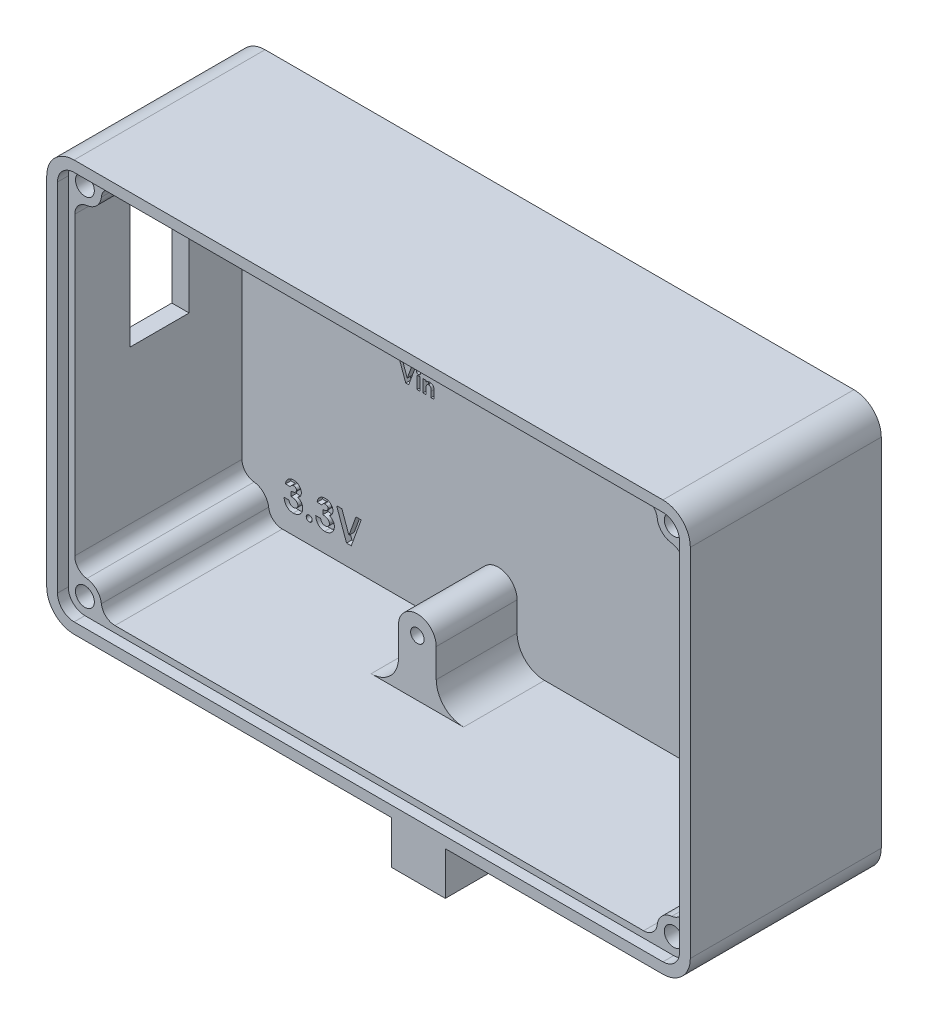
from build123d import *

# Parameters (mm, degrees)
ENCLOSURE_BASE_DEPTH      = 2.400000026
ENCLOSURE_START           = 2.4
ENCLOSURE_WALL_DEPTH      = 33.02
SKETCH6_R                 = 1.25000004
ODROID_MOUNT_SPACER_DEPTH = 14.999999972
SKETCH7_W                 = 11.000000098
SKETCH7_H                 = 26.00000007
POWER_SWITCH_HOLE_DEPTH   = 7.112
SKETCH8_W                 = 0.569871795
SKETCH8_H                 = 2.320192308
LABELING_DEPTH            = 1.000000032
TOP_START                 = -2.000000064
TOP_COVER_GROOVE_DEPTH    = 2.000000064
SKETCH10_R                = 3.079999936
SKETCH10_R_2              = 1.750000056
BOSS_EXTRUDE4_DEPTH       = 33.419999962
FILLET1_R                 = 2.54
SKETCH12_W                = 10.000000066
SKETCH12_H                = 8.000000002
BOSS_EXTRUDE5_DEPTH       = 35.420000026
SKETCH16_R                = 1.750000056
CUT_EXTRUDE1_DEPTH        = 8.000000002
FILLET2_R                 = 5.08


with BuildPart() as part:
    # Sketch5 → Enclosure Base (new body)
    with BuildSketch(Plane.XY):
        with BuildLine():
            Line((44.569600274, -38.1), (-64.650399726, -38.1))
            ThreePointArc((-64.650399726, -38.1), (-68.242502174, -36.612102448), (-69.730399726, -33.02))
            Line((-69.730399726, -33.02), (-69.730399726, 33.02))
            ThreePointArc((-69.730399726, 33.02), (-68.242502174, 36.612102448), (-64.650399726, 38.1))
            Line((-64.650399726, 38.1), (44.569600274, 38.1))
            ThreePointArc((44.569600274, 38.1), (48.161702723, 36.612102448), (49.649600274, 33.02))
            Line((49.649600274, 33.02), (49.649600274, -33.02))
            ThreePointArc((49.649600274, -33.02), (48.161702723, -36.612102448), (44.569600274, -38.1))
        make_face()
    extrude(amount=ENCLOSURE_BASE_DEPTH)

    # Sketch5<3> → Enclosure Wall (add)
    with BuildSketch(Plane.XY.offset(ENCLOSURE_START)):
        with BuildLine():
            Line((44.569600274, 38.1), (-64.650399726, 38.1))
            ThreePointArc((-64.650399726, 38.1), (-68.242502174, 36.612102448), (-69.730399726, 33.02))
            Line((-69.730399726, 33.02), (-69.730399726, -33.02))
            ThreePointArc((-69.730399726, -33.02), (-68.242502174, -36.612102448), (-64.650399726, -38.1))
            Line((-64.650399726, -38.1), (44.569600274, -38.1))
            ThreePointArc((44.569600274, -38.1), (48.161702723, -36.612102448), (49.649600274, -33.02))
            Line((49.649600274, -33.02), (49.649600274, 33.02))
            ThreePointArc((49.649600274, 33.02), (48.161702723, 36.612102448), (44.569600274, 38.1))
        make_face()
        with BuildLine():
            ThreePointArc((46.449600324, 33.02), (45.898961058, 34.349360784), (44.569600274, 34.90000005))
            Line((44.569600274, 34.90000005), (-64.650399726, 34.90000005))
            ThreePointArc((-64.650399726, 34.90000005), (-65.97976051, 34.349360784), (-66.530399776, 33.02))
            Line((-66.530399776, 33.02), (-66.530399776, -33.02))
            ThreePointArc((-66.530399776, -33.02), (-65.97976051, -34.349360784), (-64.650399726, -34.90000005))
            Line((-64.650399726, -34.90000005), (44.569600274, -34.90000005))
            ThreePointArc((44.569600274, -34.90000005), (45.898961058, -34.349360784), (46.449600324, -33.02))
            Line((46.449600324, -33.02), (46.449600324, 33.02))
        make_face(mode=Mode.SUBTRACT)
    extrude(amount=ENCLOSURE_WALL_DEPTH)

    # Sketch6 → Odroid Mount Spacer (add)
    # profile 1 of 4: a face of its own
    with BuildSketch(Plane.XY.offset(2.400000026)):
        with BuildLine():
            Line((-22.500000339, 24.499999895), (-22.500000339, 34.90000005))
            Line((-22.500000339, 34.90000005), (-15.500000115, 34.90000005))
            Line((-15.500000115, 34.90000005), (-15.500000115, 24.499999895))
            ThreePointArc((-15.500000115, 24.499999895), (-19.000000227, 20.999999783), (-22.500000339, 24.499999895))
        make_face()
        with Locations((-19.000000227, 24.499999895)):
            Circle(SKETCH6_R, mode=Mode.SUBTRACT)
    # profile 2 of 4: a face of its own
    with BuildSketch(Plane.XY.offset(2.400000026)):
        with BuildLine():
            Line((35.499999739, 24.499999895), (35.499999739, 34.90000005))
            Line((35.499999739, 34.90000005), (42.499999963, 34.90000005))
            Line((42.499999963, 34.90000005), (42.499999963, 24.499999895))
            ThreePointArc((42.499999963, 24.499999895), (38.999999851, 20.999999783), (35.499999739, 24.499999895))
        make_face()
        with Locations((38.999999851, 24.499999895)):
            Circle(SKETCH6_R, mode=Mode.SUBTRACT)
    # profile 3 of 4: a face of its own
    with BuildSketch(Plane.XY.offset(2.400000026)):
        with BuildLine():
            Line((-22.500000339, -24.500000149), (-22.500000339, -34.90000005))
            Line((-22.500000339, -34.90000005), (-15.500000115, -34.90000005))
            Line((-15.500000115, -34.90000005), (-15.500000115, -24.500000149))
            ThreePointArc((-15.500000115, -24.500000149), (-19.000000227, -21.000000037), (-22.500000339, -24.500000149))
        make_face()
        with Locations((-19.000000227, -24.500000149)):
            Circle(SKETCH6_R, mode=Mode.SUBTRACT)
    # profile 4 of 4: a face of its own
    with BuildSketch(Plane.XY.offset(2.400000026)):
        with BuildLine():
            Line((35.499999739, -24.500000149), (35.499999739, -34.90000005))
            Line((35.499999739, -34.90000005), (42.499999963, -34.90000005))
            Line((42.499999963, -34.90000005), (42.499999963, -24.500000149))
            ThreePointArc((42.499999963, -24.500000149), (38.999999851, -21.000000037), (35.499999739, -24.500000149))
        make_face()
        with Locations((38.999999851, -24.500000149)):
            Circle(SKETCH6_R, mode=Mode.SUBTRACT)
    extrude(amount=ODROID_MOUNT_SPACER_DEPTH)

    # Sketch7 → Power Switch Hole (cut)
    with BuildSketch(Plane.ZY.offset(69.730399726)):
        with Locations((17.710000013, 13.974684289)):
            Rectangle(SKETCH7_W, SKETCH7_H)
    extrude(amount=-POWER_SWITCH_HOLE_DEPTH, mode=Mode.SUBTRACT)

    # Sketch8 → Labeling (cut)
    # profile 1 of 12: a face of its own
    with BuildSketch(Plane.XY.offset(2.400000026)):
        with BuildLine():
            Line((-57.542707468, -27.351052951), (-58.45450234, -27.351052951))
            add(Edge.make_bspline(
                [(-58.45450234, -27.351052951), (-58.448064721, -27.305475578), (-58.435444196, -27.216124157), (-58.405244969, -27.086765559), (-58.369123433, -26.964060076), (-58.324027542, -26.848396291), (-58.271137398, -26.739568168), (-58.210990834, -26.637202263), (-58.142937645, -26.541737949), (-58.090774155, -26.484229867), (-58.064750737, -26.45554013)],
                knots=[0, 0, 0, 0, 1.111473889, 2.178970933, 3.205615836, 4.199322666, 5.174200091, 6.12565194, 7.064921805, 8, 8, 8, 8], degree=3))
            add(Edge.make_bspline(
                [(-58.064750737, -26.45554013), (-58.027215406, -26.417686101), (-57.953237212, -26.343079787), (-57.829610973, -26.247517341), (-57.700027844, -26.164814542), (-57.561888978, -26.099247165), (-57.41734392, -26.046177969), (-57.265243198, -26.01053127), (-57.10620835, -25.986879371), (-56.997687073, -25.984549577), (-56.942306827, -25.983360643)],
                knots=[0, 0, 0, 0, 1.01925491, 2.00884431, 2.983262333, 3.955970413, 4.92937149, 5.924503185, 6.940838805, 8, 8, 8, 8], degree=3))
            add(Edge.make_bspline(
                [(-56.942306827, -25.983360643), (-56.893070938, -25.984523006), (-56.796283103, -25.986807977), (-56.654029338, -26.005150485), (-56.518402278, -26.037321202), (-56.387968305, -26.079383693), (-56.264645678, -26.136616742), (-56.145712547, -26.203052129), (-56.034491908, -26.284537893), (-55.930723525, -26.376608605), (-55.835392475, -26.476192094), (-55.752835367, -26.582638654), (-55.681859541, -26.693104851), (-55.623384848, -26.808508453), (-55.578425755, -26.929044734), (-55.547222811, -27.054017373), (-55.526799727, -27.183150609), (-55.524765054, -27.270920731), (-55.523733109, -27.315435963)],
                knots=[0, 0, 0, 0, 1.091422571, 2.145516843, 3.172569842, 4.178562979, 5.178154469, 6.181868002, 7.194278174, 8.227918432, 9.254613415, 10.245994977, 11.209837596, 12.161663635, 13.10878368, 14.055455738, 15.013766427, 16, 16, 16, 16], degree=3))
            add(Edge.make_bspline(
                [(-55.523733109, -27.315435963), (-55.525850722, -27.370564372), (-55.53001965, -27.47909526), (-55.564228726, -27.637938279), (-55.617775233, -27.789820551), (-55.69512837, -27.932617015), (-55.791839492, -28.06593906), (-55.910500801, -28.18532933), (-56.047732513, -28.292659702), (-56.150754187, -28.350339057), (-56.20350875, -28.379875066)],
                knots=[0, 0, 0, 0, 0.992805628, 1.954529043, 2.915727527, 3.886831945, 4.871318353, 5.87440735, 6.911542536, 8, 8, 8, 8], degree=3))
            add(Edge.make_bspline(
                [(-56.20350875, -28.379875066), (-56.167298828, -28.391763546), (-56.096147954, -28.415123876), (-55.995015542, -28.461131781), (-55.898850175, -28.511410796), (-55.809307785, -28.569821757), (-55.725497765, -28.634002784), (-55.647931031, -28.704502519), (-55.57614414, -28.781167241), (-55.511308983, -28.864418576), (-55.453765248, -28.952925081), (-55.402134319, -29.044642309), (-55.359639186, -29.140961167), (-55.323640518, -29.240781629), (-55.296233182, -29.34500083), (-55.276935968, -29.453214928), (-55.265781705, -29.565177079), (-55.26408049, -29.641031369), (-55.263220288, -29.679386284)],
                knots=[0, 0, 0, 0, 1.059543567, 2.081955587, 3.086750234, 4.076226789, 5.052108497, 6.020845489, 6.989030705, 7.970690546, 8.952259656, 9.923888338, 10.895517021, 11.877585046, 12.873342345, 13.889638361, 14.932918083, 16, 16, 16, 16], degree=3))
            add(Edge.make_bspline(
                [(-55.263220288, -29.679386284), (-55.264964032, -29.735752436), (-55.26840234, -29.846895009), (-55.290261493, -30.010596645), (-55.330959296, -30.16667161), (-55.384499511, -30.316915783), (-55.455916347, -30.459389566), (-55.539961956, -30.597362539), (-55.643270896, -30.726049836), (-55.758081044, -30.848853616), (-55.885584407, -30.960501314), (-56.023818795, -31.057294844), (-56.169744553, -31.140360915), (-56.324284911, -31.207796318), (-56.487386179, -31.25972929), (-56.658684818, -31.297268837), (-56.838900578, -31.320236153), (-56.961911935, -31.32264384), (-57.024734712, -31.323873463)],
                knots=[0, 0, 0, 0, 1.005138573, 1.981928558, 2.936866704, 3.876260664, 4.820238198, 5.773547, 6.751179199, 7.756627054, 8.768222608, 9.766606018, 10.760583154, 11.757261445, 12.767156078, 13.807575856, 14.880313354, 16, 16, 16, 16], degree=3))
            add(Edge.make_bspline(
                [(-57.024734712, -31.323873463), (-57.084164045, -31.322577034), (-57.200370243, -31.320042037), (-57.370346129, -31.298100354), (-57.531892119, -31.262706639), (-57.685420481, -31.212816262), (-57.830337226, -31.14811697), (-57.967956517, -31.071074631), (-58.095532189, -30.97724562), (-58.214485688, -30.870865557), (-58.322178266, -30.751513167), (-58.41843007, -30.621953189), (-58.50111873, -30.481692958), (-58.570583354, -30.331331726), (-58.626280886, -30.170605712), (-58.670214935, -29.999841763), (-58.700903588, -29.818706257), (-58.710249881, -29.694081176), (-58.71501516, -29.63054013)],
                knots=[0, 0, 0, 0, 1.066544725, 2.085487077, 3.070979577, 4.031932826, 4.977951092, 5.916076795, 6.857635327, 7.814973522, 8.776389752, 9.738577119, 10.707772778, 11.69409279, 12.707140348, 13.757286496, 14.856535458, 16, 16, 16, 16], degree=3))
            Line((-58.71501516, -29.63054013), (-57.803220288, -29.63054013))
            add(Edge.make_bspline(
                [(-57.803220288, -29.63054013), (-57.797442339, -29.662489402), (-57.786188268, -29.724718988), (-57.764237893, -29.814813594), (-57.735633492, -29.89797648), (-57.702559687, -29.974946796), (-57.666834999, -30.046735134), (-57.623671032, -30.110690175), (-57.576230617, -30.168548559), (-57.507773751, -30.237331243), (-57.409909945, -30.30800258), (-57.277761387, -30.369419334), (-57.13075863, -30.405417098), (-57.027989041, -30.409808714), (-56.974870929, -30.412078592)],
                knots=[0, 0, 0, 0, 0.928156231, 1.807827665, 2.648129825, 3.438902246, 4.202261636, 4.936546065, 5.639352463, 6.338805438, 7.70633318, 9.064371875, 10.482673459, 12, 12, 12, 12], degree=3))
            add(Edge.make_bspline(
                [(-56.974870929, -30.412078592), (-56.946684582, -30.411595243), (-56.891473832, -30.41064847), (-56.810377462, -30.400154763), (-56.733121751, -30.382871619), (-56.659562807, -30.359384468), (-56.589232348, -30.329941855), (-56.523474108, -30.291977368), (-56.46094777, -30.247838232), (-56.402333053, -30.198214125), (-56.348171847, -30.144141613), (-56.303106537, -30.084265493), (-56.261920106, -30.023420652), (-56.231458324, -29.957626408), (-56.204767241, -29.890423194), (-56.188430935, -29.819371743), (-56.17609585, -29.745962524), (-56.175378984, -29.695724477), (-56.17501516, -29.67022763)],
                knots=[0, 0, 0, 0, 1.110435564, 2.175094844, 3.216326037, 4.226890168, 5.215276772, 6.21526065, 7.213097102, 8.228249917, 9.239874822, 10.221364777, 11.178138315, 12.128914389, 13.072518965, 14.022636769, 14.996447288, 16, 16, 16, 16], degree=3))
            add(Edge.make_bspline(
                [(-56.17501516, -29.67022763), (-56.175981045, -29.642342484), (-56.177903901, -29.586829547), (-56.193613832, -29.505820088), (-56.218423134, -29.427895518), (-56.252886285, -29.353400923), (-56.298907982, -29.282610875), (-56.353213071, -29.214105111), (-56.420079895, -29.151449236), (-56.493441756, -29.089515801), (-56.578512694, -29.035528526), (-56.671149636, -28.985706202), (-56.773787224, -28.946063015), (-56.883919983, -28.910654305), (-57.003631177, -28.884792334), (-57.132177443, -28.866014022), (-57.269351419, -28.852036479), (-57.363907223, -28.85003117), (-57.412451058, -28.849001669)],
                knots=[0, 0, 0, 0, 0.809814727, 1.612155564, 2.388397, 3.182215007, 3.988903953, 4.837162975, 5.715530372, 6.646997145, 7.623086902, 8.637258368, 9.698941581, 10.815059213, 11.996518529, 13.252603015, 14.589518788, 16, 16, 16, 16], degree=3))
            Line((-57.412451058, -28.849001669), (-57.412451058, -28.002335002))
            add(Edge.make_bspline(
                [(-57.412451058, -28.002335002), (-57.352011096, -27.997187741), (-57.238939898, -27.987558236), (-57.081991012, -27.965039304), (-56.949860282, -27.934939044), (-56.839371943, -27.898624708), (-56.747629506, -27.851987641), (-56.667483819, -27.800502379), (-56.598458563, -27.74070977), (-56.540122962, -27.674392824), (-56.493456296, -27.603174642), (-56.460428349, -27.528162166), (-56.438618418, -27.451676376), (-56.436551928, -27.3993624), (-56.435527981, -27.373440771)],
                knots=[0, 0, 0, 0, 1.70044513, 3.18119609, 4.440695891, 5.496282586, 6.431922213, 7.318171381, 8.16090191, 8.983045123, 9.787564368, 10.536848927, 11.275007137, 12, 12, 12, 12], degree=3))
            add(Edge.make_bspline(
                [(-56.435527981, -27.373440771), (-56.437294583, -27.340367587), (-56.440742618, -27.275815735), (-56.467521921, -27.183428435), (-56.514007757, -27.101072815), (-56.5763371, -27.028922173), (-56.652287572, -26.96865655), (-56.741314839, -26.924904735), (-56.841487005, -26.89919859), (-56.911963522, -26.896533729), (-56.948412596, -26.895155515)],
                knots=[0, 0, 0, 0, 1.009664648, 1.970651636, 2.907870547, 3.878035693, 4.867062054, 5.849714035, 6.887914197, 8, 8, 8, 8], degree=3))
            add(Edge.make_bspline(
                [(-56.948412596, -26.895155515), (-56.981449584, -26.896781662), (-57.047005087, -26.900008437), (-57.142866853, -26.924092229), (-57.233903593, -26.964634297), (-57.318230194, -27.020539418), (-57.394629382, -27.087679099), (-57.457331074, -27.167192115), (-57.509483368, -27.254314703), (-57.531589352, -27.318680455), (-57.542707468, -27.351052951)],
                knots=[0, 0, 0, 0, 0.98818071, 1.960853194, 2.938124878, 3.957524365, 4.978590984, 5.968022688, 6.978025184, 8, 8, 8, 8], degree=3))
        make_face()
    # profile 2 of 12: a face of its own
    with BuildSketch(Plane.XY.offset(2.400000026)):
        with BuildLine():
            add(Edge.make_bspline(
                [(-54.058348494, -30.151565771), (-54.021540416, -30.15358387), (-53.949071667, -30.157557157), (-53.844364207, -30.187209385), (-53.749865121, -30.240483837), (-53.665370312, -30.309971126), (-53.593923629, -30.393573612), (-53.542283582, -30.488912026), (-53.51012603, -30.593216034), (-53.506575814, -30.665912778), (-53.50475875, -30.703120258)],
                knots=[0, 0, 0, 0, 1.016957001, 2.002212695, 2.9757545, 3.99499976, 5.013036768, 5.994806404, 6.97370641, 8, 8, 8, 8], degree=3))
            add(Edge.make_bspline(
                [(-53.50475875, -30.703120258), (-53.50656391, -30.740333715), (-53.510090869, -30.813042134), (-53.542506109, -30.917549386), (-53.593846462, -31.013671394), (-53.665376044, -31.098169736), (-53.749515199, -31.168966578), (-53.844581477, -31.221749762), (-53.948872202, -31.253084085), (-54.021505307, -31.256840045), (-54.058348494, -31.258745258)],
                knots=[0, 0, 0, 0, 1.023218912, 1.999186227, 2.986238111, 4.008388923, 5.030539734, 6.0011649, 6.986089706, 8, 8, 8, 8], degree=3))
            add(Edge.make_bspline(
                [(-54.058348494, -31.258745258), (-54.09520041, -31.256855538), (-54.167850726, -31.25313012), (-54.272303563, -31.221485644), (-54.368071694, -31.169318979), (-54.452231989, -31.09808386), (-54.524081134, -31.01397061), (-54.573961833, -30.917246104), (-54.606679012, -30.813081534), (-54.610157755, -30.740347054), (-54.611938237, -30.703120258)],
                knots=[0, 0, 0, 0, 1.013427518, 1.99788335, 2.976245624, 3.997909735, 5.019573847, 6.001765691, 6.977268297, 8, 8, 8, 8], degree=3))
            add(Edge.make_bspline(
                [(-54.611938237, -30.703120258), (-54.610146008, -30.665899207), (-54.606644315, -30.593175947), (-54.574183726, -30.489218801), (-54.524001191, -30.39327277), (-54.452237981, -30.310057181), (-54.367719969, -30.240134187), (-54.272522052, -30.187469883), (-54.167651361, -30.157510782), (-54.095165343, -30.153568249), (-54.058348494, -30.151565771)],
                knots=[0, 0, 0, 0, 1.025808215, 2.00424526, 2.981110158, 3.998665696, 5.017428914, 5.998734231, 6.983523959, 8, 8, 8, 8], degree=3))
        make_face()
    # profile 3 of 12: a face of its own
    with BuildSketch(Plane.XY.offset(2.400000026)):
        with BuildLine():
            Line((-51.681169006, -27.351052951), (-52.592963878, -27.351052951))
            add(Edge.make_bspline(
                [(-52.592963878, -27.351052951), (-52.58652626, -27.305475578), (-52.573905735, -27.216124157), (-52.543706507, -27.086765559), (-52.507584972, -26.964060076), (-52.46248908, -26.848396291), (-52.409598936, -26.739568168), (-52.349452373, -26.637202263), (-52.281399184, -26.541737949), (-52.229235693, -26.484229867), (-52.203212276, -26.45554013)],
                knots=[0, 0, 0, 0, 1.111473889, 2.178970933, 3.205615836, 4.199322666, 5.174200091, 6.12565194, 7.064921805, 8, 8, 8, 8], degree=3))
            add(Edge.make_bspline(
                [(-52.203212276, -26.45554013), (-52.165676944, -26.417686101), (-52.09169875, -26.343079787), (-51.968072511, -26.247517341), (-51.838489382, -26.164814542), (-51.700350516, -26.099247165), (-51.555805459, -26.046177969), (-51.403704737, -26.01053127), (-51.244669889, -25.986879371), (-51.136148612, -25.984549577), (-51.080768365, -25.983360643)],
                knots=[0, 0, 0, 0, 1.01925491, 2.00884431, 2.983262333, 3.955970413, 4.92937149, 5.924503185, 6.940838805, 8, 8, 8, 8], degree=3))
            add(Edge.make_bspline(
                [(-51.080768365, -25.983360643), (-51.031532477, -25.984523006), (-50.934744641, -25.986807977), (-50.792490876, -26.005150485), (-50.656863816, -26.037321202), (-50.526429843, -26.079383693), (-50.403107216, -26.136616742), (-50.284174085, -26.203052129), (-50.172953446, -26.284537893), (-50.069185064, -26.376608605), (-49.973854013, -26.476192094), (-49.891296906, -26.582638654), (-49.820321079, -26.693104851), (-49.761846386, -26.808508453), (-49.716887293, -26.929044734), (-49.68568435, -27.054017373), (-49.665261265, -27.183150609), (-49.663226592, -27.270920731), (-49.662194647, -27.315435963)],
                knots=[0, 0, 0, 0, 1.091422571, 2.145516843, 3.172569842, 4.178562979, 5.178154469, 6.181868002, 7.194278174, 8.227918432, 9.254613415, 10.245994977, 11.209837596, 12.161663635, 13.10878368, 14.055455738, 15.013766427, 16, 16, 16, 16], degree=3))
            add(Edge.make_bspline(
                [(-49.662194647, -27.315435963), (-49.66431226, -27.370564372), (-49.668481189, -27.47909526), (-49.702690265, -27.637938279), (-49.756236771, -27.789820551), (-49.833589908, -27.932617015), (-49.930301031, -28.06593906), (-50.048962339, -28.18532933), (-50.186194052, -28.292659702), (-50.289215726, -28.350339057), (-50.341970288, -28.379875066)],
                knots=[0, 0, 0, 0, 0.992805628, 1.954529043, 2.915727527, 3.886831945, 4.871318353, 5.87440735, 6.911542536, 8, 8, 8, 8], degree=3))
            add(Edge.make_bspline(
                [(-50.341970288, -28.379875066), (-50.305760366, -28.391763546), (-50.234609492, -28.415123876), (-50.133477081, -28.461131781), (-50.037311714, -28.511410796), (-49.947769323, -28.569821757), (-49.863959304, -28.634002784), (-49.78639257, -28.704502519), (-49.714605678, -28.781167241), (-49.649770522, -28.864418576), (-49.592226787, -28.952925081), (-49.540595858, -29.044642309), (-49.498100725, -29.140961167), (-49.462102057, -29.240781629), (-49.434694721, -29.34500083), (-49.415397507, -29.453214928), (-49.404243244, -29.565177079), (-49.402542028, -29.641031369), (-49.401681827, -29.679386284)],
                knots=[0, 0, 0, 0, 1.059543567, 2.081955587, 3.086750234, 4.076226789, 5.052108497, 6.020845489, 6.989030705, 7.970690546, 8.952259656, 9.923888338, 10.895517021, 11.877585046, 12.873342345, 13.889638361, 14.932918083, 16, 16, 16, 16], degree=3))
            add(Edge.make_bspline(
                [(-49.401681827, -29.679386284), (-49.403425571, -29.735752436), (-49.406863879, -29.846895009), (-49.428723031, -30.010596645), (-49.469420835, -30.16667161), (-49.522961049, -30.316915783), (-49.594377885, -30.459389566), (-49.678423494, -30.597362539), (-49.781732434, -30.726049836), (-49.896542583, -30.848853616), (-50.024045946, -30.960501314), (-50.162280334, -31.057294844), (-50.308206092, -31.140360915), (-50.46274645, -31.207796318), (-50.625847718, -31.25972929), (-50.797146357, -31.297268837), (-50.977362117, -31.320236153), (-51.100373473, -31.32264384), (-51.16319625, -31.323873463)],
                knots=[0, 0, 0, 0, 1.005138573, 1.981928558, 2.936866704, 3.876260664, 4.820238198, 5.773547, 6.751179199, 7.756627054, 8.768222608, 9.766606018, 10.760583154, 11.757261445, 12.767156078, 13.807575856, 14.880313354, 16, 16, 16, 16], degree=3))
            add(Edge.make_bspline(
                [(-51.16319625, -31.323873463), (-51.222625584, -31.322577034), (-51.338831782, -31.320042037), (-51.508807667, -31.298100354), (-51.670353657, -31.262706639), (-51.823882019, -31.212816262), (-51.968798765, -31.14811697), (-52.106418055, -31.071074631), (-52.233993728, -30.97724562), (-52.352947227, -30.870865557), (-52.460639805, -30.751513167), (-52.556891608, -30.621953189), (-52.639580269, -30.481692958), (-52.709044893, -30.331331726), (-52.764742424, -30.170605712), (-52.808676474, -29.999841763), (-52.839365126, -29.818706257), (-52.84871142, -29.694081176), (-52.853476699, -29.63054013)],
                knots=[0, 0, 0, 0, 1.066544725, 2.085487077, 3.070979577, 4.031932826, 4.977951092, 5.916076795, 6.857635327, 7.814973522, 8.776389752, 9.738577119, 10.707772778, 11.69409279, 12.707140348, 13.757286496, 14.856535458, 16, 16, 16, 16], degree=3))
            Line((-52.853476699, -29.63054013), (-51.941681827, -29.63054013))
            add(Edge.make_bspline(
                [(-51.941681827, -29.63054013), (-51.935903878, -29.662489402), (-51.924649807, -29.724718988), (-51.902699432, -29.814813594), (-51.87409503, -29.89797648), (-51.841021226, -29.974946796), (-51.805296537, -30.046735134), (-51.762132571, -30.110690175), (-51.714692155, -30.168548559), (-51.646235289, -30.237331243), (-51.548371484, -30.30800258), (-51.416222925, -30.369419334), (-51.269220168, -30.405417098), (-51.16645058, -30.409808714), (-51.113332468, -30.412078592)],
                knots=[0, 0, 0, 0, 0.928156231, 1.807827665, 2.648129825, 3.438902246, 4.202261636, 4.936546065, 5.639352463, 6.338805438, 7.70633318, 9.064371875, 10.482673459, 12, 12, 12, 12], degree=3))
            add(Edge.make_bspline(
                [(-51.113332468, -30.412078592), (-51.08514612, -30.411595243), (-51.029935371, -30.41064847), (-50.948839001, -30.400154763), (-50.87158329, -30.382871619), (-50.798024345, -30.359384468), (-50.727693886, -30.329941855), (-50.661935646, -30.291977368), (-50.599409309, -30.247838232), (-50.540794592, -30.198214125), (-50.486633385, -30.144141613), (-50.441568076, -30.084265493), (-50.400381644, -30.023420652), (-50.369919863, -29.957626408), (-50.343228779, -29.890423194), (-50.326892473, -29.819371743), (-50.314557388, -29.745962524), (-50.313840523, -29.695724477), (-50.313476699, -29.67022763)],
                knots=[0, 0, 0, 0, 1.110435564, 2.175094844, 3.216326037, 4.226890168, 5.215276772, 6.21526065, 7.213097102, 8.228249917, 9.239874822, 10.221364777, 11.178138315, 12.128914389, 13.072518965, 14.022636769, 14.996447288, 16, 16, 16, 16], degree=3))
            add(Edge.make_bspline(
                [(-50.313476699, -29.67022763), (-50.314442584, -29.642342484), (-50.316365439, -29.586829547), (-50.33207537, -29.505820088), (-50.356884672, -29.427895518), (-50.391347823, -29.353400923), (-50.43736952, -29.282610875), (-50.491674609, -29.214105111), (-50.558541433, -29.151449236), (-50.631903294, -29.089515801), (-50.716974232, -29.035528526), (-50.809611174, -28.985706202), (-50.912248762, -28.946063015), (-51.022381521, -28.910654305), (-51.142092715, -28.884792334), (-51.270638982, -28.866014022), (-51.407812957, -28.852036479), (-51.502368761, -28.85003117), (-51.550912596, -28.849001669)],
                knots=[0, 0, 0, 0, 0.809814727, 1.612155564, 2.388397, 3.182215007, 3.988903953, 4.837162975, 5.715530372, 6.646997145, 7.623086902, 8.637258368, 9.698941581, 10.815059213, 11.996518529, 13.252603015, 14.589518788, 16, 16, 16, 16], degree=3))
            Line((-51.550912596, -28.849001669), (-51.550912596, -28.002335002))
            add(Edge.make_bspline(
                [(-51.550912596, -28.002335002), (-51.490472635, -27.997187741), (-51.377401437, -27.987558236), (-51.220452551, -27.965039304), (-51.088321821, -27.934939044), (-50.977833482, -27.898624708), (-50.886091044, -27.851987641), (-50.805945358, -27.800502379), (-50.736920101, -27.74070977), (-50.6785845, -27.674392824), (-50.631917834, -27.603174642), (-50.598889887, -27.528162166), (-50.577079956, -27.451676376), (-50.575013467, -27.3993624), (-50.573989519, -27.373440771)],
                knots=[0, 0, 0, 0, 1.70044513, 3.18119609, 4.440695891, 5.496282586, 6.431922213, 7.318171381, 8.16090191, 8.983045123, 9.787564368, 10.536848927, 11.275007137, 12, 12, 12, 12], degree=3))
            add(Edge.make_bspline(
                [(-50.573989519, -27.373440771), (-50.575756122, -27.340367587), (-50.579204156, -27.275815735), (-50.605983459, -27.183428435), (-50.652469295, -27.101072815), (-50.714798638, -27.028922173), (-50.79074911, -26.96865655), (-50.879776378, -26.924904735), (-50.979948544, -26.89919859), (-51.05042506, -26.896533729), (-51.086874135, -26.895155515)],
                knots=[0, 0, 0, 0, 1.009664648, 1.970651636, 2.907870547, 3.878035693, 4.867062054, 5.849714035, 6.887914197, 8, 8, 8, 8], degree=3))
            add(Edge.make_bspline(
                [(-51.086874135, -26.895155515), (-51.119911122, -26.896781662), (-51.185466625, -26.900008437), (-51.281328392, -26.924092229), (-51.372365132, -26.964634297), (-51.456691732, -27.020539418), (-51.533090921, -27.087679099), (-51.595792612, -27.167192115), (-51.647944907, -27.254314703), (-51.670050891, -27.318680455), (-51.681169006, -27.351052951)],
                knots=[0, 0, 0, 0, 0.98818071, 1.960853194, 2.938124878, 3.957524365, 4.978590984, 5.968022688, 6.978025184, 8, 8, 8, 8], degree=3))
        make_face()
    # profile 4 of 12: a face of its own
    with BuildSketch(Plane.XY.offset(2.400000026)):
        Polygon((-48.978348494, -26.113617053), (-48.004478301, -26.113617053), (-46.698861314, -29.722126669), (-45.390191442, -26.113617053), (-44.419374135, -26.113617053), (-46.261281186, -31.193617053), (-47.139494327, -31.193617053), align=None)
    # profile 5 of 12: a face of its own
    with BuildSketch(Plane.XY.offset(2.400000026)):
        with BuildLine():
            Line((-57.771673814, 31.036382947), (-55.458604904, 31.036382947))
            Line((-55.458604904, 31.036382947), (-55.458604904, 30.18971628))
            Line((-55.458604904, 30.18971628), (-57.049157788, 30.18971628))
            Line((-57.049157788, 30.18971628), (-57.247595288, 29.229075255))
            add(Edge.make_bspline(
                [(-57.247595288, 29.229075255), (-57.220555338, 29.236606222), (-57.167227002, 29.251458837), (-57.086887796, 29.266354131), (-57.00902791, 29.276008787), (-56.957936727, 29.277296589), (-56.933148173, 29.277921408)],
                knots=[0, 0, 0, 0, 1.05461699, 2.079921384, 3.068411212, 4, 4, 4, 4], degree=3))
            add(Edge.make_bspline(
                [(-56.933148173, 29.277921408), (-56.879131317, 29.276683643), (-56.772652194, 29.274243736), (-56.61688675, 29.251081056), (-56.467732134, 29.214600538), (-56.325644778, 29.162571792), (-56.190763482, 29.094855035), (-56.062924743, 29.012936742), (-55.941971659, 28.916673034), (-55.830052868, 28.806003642), (-55.727217208, 28.684486144), (-55.637807467, 28.553052111), (-55.561445968, 28.413575666), (-55.500710672, 28.265189826), (-55.452773199, 28.108826554), (-55.41813251, 27.944385647), (-55.39764774, 27.771672218), (-55.394885494, 27.653842194), (-55.393476699, 27.593746729)],
                knots=[0, 0, 0, 0, 1.01440847, 1.999622559, 2.951875003, 3.895578053, 4.836219714, 5.782137149, 6.743708247, 7.735272588, 8.734977101, 9.730283169, 10.717124674, 11.717316708, 12.737475749, 13.78628267, 14.87096371, 16, 16, 16, 16], degree=3))
            add(Edge.make_bspline(
                [(-55.393476699, 27.593746729), (-55.39519827, 27.532969041), (-55.398595433, 27.413036896), (-55.420758808, 27.236694221), (-55.459877563, 27.067797748), (-55.513611087, 26.905895344), (-55.584401565, 26.752176956), (-55.669536803, 26.605050174), (-55.77045621, 26.465607074), (-55.886169418, 26.335277117), (-56.011964855, 26.216153034), (-56.1459073, 26.111359349), (-56.287055767, 26.023176313), (-56.435413662, 25.951909511), (-56.59012981, 25.895524487), (-56.751251166, 25.85447888), (-56.919560762, 25.830941505), (-57.033821109, 25.827749163), (-57.091898173, 25.826126537)],
                knots=[0, 0, 0, 0, 1.06808661, 2.107647099, 3.116961351, 4.110378221, 5.100014249, 6.085620622, 7.093190682, 8.119403071, 9.144090782, 10.133780668, 11.103064255, 12.062861538, 13.020824475, 13.992378307, 14.979551724, 16, 16, 16, 16], degree=3))
            add(Edge.make_bspline(
                [(-57.091898173, 25.826126537), (-57.143834763, 25.827453946), (-57.246264587, 25.830071875), (-57.397139221, 25.846163047), (-57.542599122, 25.87461239), (-57.681872058, 25.915785956), (-57.816423412, 25.966461216), (-57.944697733, 26.029840205), (-58.067399909, 26.104716102), (-58.184181513, 26.189722421), (-58.29314501, 26.285478741), (-58.392595345, 26.390300533), (-58.483134601, 26.502866567), (-58.562825381, 26.624565567), (-58.631417878, 26.75521773), (-58.692247104, 26.893283289), (-58.742036435, 27.04020409), (-58.767303086, 27.142057752), (-58.780143365, 27.193818844)],
                knots=[0, 0, 0, 0, 1.054957082, 2.080596141, 3.077793124, 4.061112343, 5.027190972, 5.994718051, 6.962465889, 7.943658696, 8.924948258, 9.904494768, 10.875059, 11.855380583, 12.854004648, 13.869083016, 14.917087635, 16, 16, 16, 16], degree=3))
            Line((-58.780143365, 27.193818844), (-57.738092083, 27.193818844))
            add(Edge.make_bspline(
                [(-57.738092083, 27.193818844), (-57.719043361, 27.157950515), (-57.682024342, 27.088244511), (-57.611605985, 26.995699317), (-57.532777105, 26.916780751), (-57.44624878, 26.850717763), (-57.351460363, 26.801224496), (-57.252274301, 26.763691092), (-57.147444562, 26.742001928), (-57.076050881, 26.739290567), (-57.039999135, 26.737921408)],
                knots=[0, 0, 0, 0, 1.104910296, 2.147267069, 3.153527244, 4.136738762, 5.099945312, 6.05603338, 7.018353, 8, 8, 8, 8], degree=3))
            add(Edge.make_bspline(
                [(-57.039999135, 26.737921408), (-57.014871551, 26.738866824), (-56.965432606, 26.740726946), (-56.892592139, 26.750567459), (-56.823062713, 26.769205166), (-56.756327393, 26.795014058), (-56.692206912, 26.827200662), (-56.631620458, 26.867834152), (-56.573513937, 26.914604805), (-56.518771966, 26.968274288), (-56.469191519, 27.028103278), (-56.42571489, 27.092393606), (-56.386840788, 27.159716727), (-56.358046146, 27.232739479), (-56.334465769, 27.309281378), (-56.317100226, 27.389919801), (-56.306722356, 27.474748928), (-56.305761642, 27.532659396), (-56.305271571, 27.562200255)],
                knots=[0, 0, 0, 0, 0.978869489, 1.925942215, 2.855067702, 3.774946051, 4.70828698, 5.642468714, 6.60995405, 7.609372294, 8.622401667, 9.629904756, 10.629323, 11.642352373, 12.678539694, 13.745912462, 14.850161547, 16, 16, 16, 16], degree=3))
            add(Edge.make_bspline(
                [(-56.305271571, 27.562200255), (-56.305840356, 27.591055403), (-56.30694751, 27.64722265), (-56.316106109, 27.729696288), (-56.332490668, 27.807948845), (-56.354814769, 27.882579676), (-56.383392284, 27.953135588), (-56.418315917, 28.020036563), (-56.459734866, 28.082944441), (-56.507871501, 28.14057848), (-56.559203913, 28.193442059), (-56.614351418, 28.239676124), (-56.672817166, 28.278047188), (-56.732784407, 28.311546243), (-56.796646816, 28.335926126), (-56.862968385, 28.352715651), (-56.931679368, 28.365035129), (-56.978545638, 28.365758944), (-57.002346891, 28.366126537)],
                knots=[0, 0, 0, 0, 1.166249705, 2.270133367, 3.348514167, 4.393962215, 5.415026464, 6.420877785, 7.440098956, 8.453121383, 9.451844239, 10.415694839, 11.355045125, 12.27538808, 13.187007209, 14.108269027, 15.039275622, 16, 16, 16, 16], degree=3))
            add(Edge.make_bspline(
                [(-57.002346891, 28.366126537), (-57.028200584, 28.365145532), (-57.080016931, 28.36317939), (-57.157003054, 28.347181414), (-57.233060938, 28.321290687), (-57.308613544, 28.285570325), (-57.38291088, 28.238823643), (-57.457913691, 28.183995145), (-57.53111147, 28.11710102), (-57.577652655, 28.067278123), (-57.601729904, 28.041503139)],
                knots=[0, 0, 0, 0, 0.88288272, 1.769486374, 2.674910571, 3.623812639, 4.617874466, 5.670434592, 6.794841017, 8, 8, 8, 8], degree=3))
            Line((-57.601729904, 28.041503139), (-58.369021571, 28.217552819))
            Line((-58.369021571, 28.217552819), (-57.771673814, 31.036382947))
        make_face()
    # profile 6 of 12: a face of its own
    with BuildSketch(Plane.XY.offset(2.400000026)):
        with BuildLine():
            add(Edge.make_bspline(
                [(-54.058348494, 26.998434229), (-54.021540416, 26.99641613), (-53.949071667, 26.992442843), (-53.844364207, 26.962790615), (-53.749865121, 26.909516163), (-53.665370312, 26.840028874), (-53.593923629, 26.756426388), (-53.542283582, 26.661087974), (-53.51012603, 26.556783966), (-53.506575814, 26.484087222), (-53.50475875, 26.446879742)],
                knots=[0, 0, 0, 0, 1.016957001, 2.002212695, 2.9757545, 3.99499976, 5.013036768, 5.994806404, 6.97370641, 8, 8, 8, 8], degree=3))
            add(Edge.make_bspline(
                [(-53.50475875, 26.446879742), (-53.50656391, 26.409666285), (-53.510090869, 26.336957866), (-53.542506109, 26.232450614), (-53.593846462, 26.136328606), (-53.665376044, 26.051830264), (-53.749515199, 25.981033422), (-53.844581477, 25.928250238), (-53.948872202, 25.896915915), (-54.021505307, 25.893159955), (-54.058348494, 25.891254742)],
                knots=[0, 0, 0, 0, 1.023218912, 1.999186227, 2.986238111, 4.008388923, 5.030539734, 6.0011649, 6.986089706, 8, 8, 8, 8], degree=3))
            add(Edge.make_bspline(
                [(-54.058348494, 25.891254742), (-54.09520041, 25.893144462), (-54.167850726, 25.89686988), (-54.272303563, 25.928514356), (-54.368071694, 25.980681021), (-54.452231989, 26.05191614), (-54.524081134, 26.13602939), (-54.573961833, 26.232753896), (-54.606679012, 26.336918466), (-54.610157755, 26.409652946), (-54.611938237, 26.446879742)],
                knots=[0, 0, 0, 0, 1.013427518, 1.99788335, 2.976245624, 3.997909735, 5.019573847, 6.001765691, 6.977268297, 8, 8, 8, 8], degree=3))
            add(Edge.make_bspline(
                [(-54.611938237, 26.446879742), (-54.610146008, 26.484100793), (-54.606644315, 26.556824053), (-54.574183726, 26.660781199), (-54.524001191, 26.75672723), (-54.452237981, 26.839942819), (-54.367719969, 26.909865813), (-54.272522052, 26.962530117), (-54.167651361, 26.992489218), (-54.095165343, 26.996431751), (-54.058348494, 26.998434229)],
                knots=[0, 0, 0, 0, 1.025808215, 2.00424526, 2.981110158, 3.998665696, 5.017428914, 5.998734231, 6.983523959, 8, 8, 8, 8], degree=3))
        make_face()
    # profile 7 of 12: a face of its own
    with BuildSketch(Plane.XY.offset(2.400000026)):
        with BuildLine():
            add(Edge.make_bspline(
                [(-51.142843686, 31.166639357), (-51.09870903, 31.165984166), (-51.011928504, 31.164695884), (-50.884117124, 31.150742748), (-50.760999428, 31.12966345), (-50.642093763, 31.10026518), (-50.528256025, 31.061357616), (-50.41865768, 31.01478593), (-50.314603264, 30.958107339), (-50.214765751, 30.894085961), (-50.119183599, 30.821604684), (-50.030154059, 30.738972286), (-49.94605126, 30.648090142), (-49.86869572, 30.547584277), (-49.796374376, 30.438368898), (-49.729324865, 30.320426687), (-49.668060466, 30.193180396), (-49.611894552, 30.056400399), (-49.561670814, 29.908036423), (-49.519367422, 29.746386669), (-49.483085185, 29.57141422), (-49.452460417, 29.382683545), (-49.429313042, 29.179943775), (-49.413711245, 28.9633296), (-49.403004553, 28.733258621), (-49.402130748, 28.57543182), (-49.401681827, 28.49434769)],
                knots=[0, 0, 0, 0, 0.879237366, 1.728815576, 2.559023295, 3.367336655, 4.166867292, 4.954216142, 5.737608147, 6.525189134, 7.316157332, 8.124696809, 8.942788509, 9.781158001, 10.649253743, 11.551476218, 12.482711956, 13.461909668, 14.496590415, 15.601789533, 16.789733467, 18.056700938, 19.410929216, 20.8549011, 22.384193279, 24, 24, 24, 24], degree=3))
            add(Edge.make_bspline(
                [(-49.401681827, 28.49434769), (-49.402166989, 28.412249107), (-49.403109651, 28.252733033), (-49.413266165, 28.020557708), (-49.430756161, 27.802370784), (-49.453298531, 27.598194835), (-49.484175412, 27.408137682), (-49.520336531, 27.231707206), (-49.563307669, 27.068967358), (-49.615185761, 26.920284825), (-49.671011701, 26.783264612), (-49.732443684, 26.656266421), (-49.79841096, 26.538946271), (-49.867400437, 26.429534226), (-49.943194373, 26.3312557), (-50.022103663, 26.240768707), (-50.107564158, 26.161520014), (-50.195977642, 26.089425498), (-50.290583057, 26.027121369), (-50.390404764, 25.972631204), (-50.497222409, 25.928433209), (-50.609088888, 25.889992154), (-50.727910989, 25.862395624), (-50.851800645, 25.840498684), (-50.982156545, 25.828397092), (-51.070908091, 25.82689581), (-51.116385353, 25.826126537)],
                knots=[0, 0, 0, 0, 1.643780988, 3.193836972, 4.651895693, 6.025988579, 7.305620092, 8.505800249, 9.631074763, 10.672816429, 11.65661981, 12.592235626, 13.49536222, 14.350718032, 15.179365177, 15.97804903, 16.751647189, 17.51006938, 18.259804725, 19.016521909, 19.783502495, 20.571750527, 21.382245291, 22.22305063, 23.089471752, 24, 24, 24, 24], degree=3))
            add(Edge.make_bspline(
                [(-51.116385353, 25.826126537), (-51.161861386, 25.826910649), (-51.250948267, 25.828446713), (-51.381656662, 25.840408704), (-51.506202871, 25.862484329), (-51.625965046, 25.890204019), (-51.740109661, 25.928348155), (-51.849184037, 25.973868522), (-51.952349485, 26.028018695), (-52.049891655, 26.090467987), (-52.14147751, 26.162080136), (-52.228530293, 26.242089169), (-52.31085744, 26.330292284), (-52.387206549, 26.427677429), (-52.458827998, 26.532944715), (-52.524974889, 26.647296244), (-52.585607469, 26.770565522), (-52.642622337, 26.902924374), (-52.69216104, 27.047222334), (-52.736248185, 27.204747966), (-52.772363215, 27.376814374), (-52.801409339, 27.563366281), (-52.824599748, 27.764008469), (-52.841850746, 27.978837781), (-52.852063675, 28.20795428), (-52.85299645, 28.365437463), (-52.853476699, 28.446519165)],
                knots=[0, 0, 0, 0, 0.917216111, 1.796812873, 2.643793957, 3.46689424, 4.273913431, 5.068098542, 5.848489301, 6.620921603, 7.401012384, 8.190319798, 9.003608147, 9.831726257, 10.68377682, 11.569763213, 12.493818149, 13.453288342, 14.474581811, 15.568529029, 16.750744269, 18.018426408, 19.375425659, 20.823733699, 22.36466933, 24, 24, 24, 24], degree=3))
            add(Edge.make_bspline(
                [(-52.853476699, 28.446519165), (-52.852606774, 28.559175807), (-52.850928242, 28.776548249), (-52.829656656, 29.090588227), (-52.798435363, 29.380863788), (-52.752578678, 29.64688937), (-52.695877523, 29.889650257), (-52.62326874, 30.107547265), (-52.540608923, 30.30359549), (-52.47017214, 30.419735638), (-52.436249135, 30.475669806)],
                knots=[0, 0, 0, 0, 1.288568992, 2.486310467, 3.599230591, 4.627010532, 5.572937695, 6.447898582, 7.252493626, 8, 8, 8, 8], degree=3))
            add(Edge.make_bspline(
                [(-52.436249135, 30.475669806), (-52.39680508, 30.530619515), (-52.319684181, 30.638057024), (-52.184836132, 30.77910239), (-52.039959462, 30.899731294), (-51.882078484, 30.997213796), (-51.713690153, 31.074088504), (-51.533348769, 31.128384245), (-51.341720303, 31.160019474), (-51.210125838, 31.164399778), (-51.142843686, 31.166639357)],
                knots=[0, 0, 0, 0, 1.058512271, 2.069600068, 3.047294572, 4.004278952, 4.967380941, 5.939006123, 6.946246673, 8, 8, 8, 8], degree=3))
        make_face()
        with BuildLine():
            add(Edge.make_bspline(
                [(-51.120455865, 30.254844485), (-51.160353961, 30.252953395), (-51.238575406, 30.249245854), (-51.352078451, 30.217774061), (-51.459104735, 30.169164181), (-51.540516771, 30.110669791), (-51.601452871, 30.054595902), (-51.64402936, 30.003850857), (-51.685087674, 29.947223044), (-51.721352444, 29.882157141), (-51.755595854, 29.810991042), (-51.789061986, 29.733401697), (-51.816495428, 29.647483342), (-51.843448056, 29.55469918), (-51.867061074, 29.452483974), (-51.886843606, 29.340002227), (-51.90451756, 29.216522461), (-51.916845353, 29.081963795), (-51.928338556, 28.936467013), (-51.936577428, 28.779708002), (-51.940021894, 28.611729055), (-51.941116785, 28.496044446), (-51.941681827, 28.436342883)],
                knots=[0, 0, 0, 0, 1.076674018, 2.110852608, 3.161083442, 4.239746716, 4.804137807, 5.395870207, 6.026861976, 6.692161227, 7.405688833, 8.16177676, 8.973626916, 9.841385931, 10.773283133, 11.807421078, 12.927755683, 14.143907515, 15.458935494, 16.872852025, 18.386167141, 20, 20, 20, 20], degree=3))
            add(Edge.make_bspline(
                [(-51.941681827, 28.436342883), (-51.940751836, 28.358996621), (-51.938968509, 28.210679431), (-51.929628277, 27.997394146), (-51.910906558, 27.803287363), (-51.887620518, 27.627043547), (-51.854914325, 27.469805688), (-51.817283733, 27.330086169), (-51.770813298, 27.209666074), (-51.717107755, 27.10680386), (-51.657626448, 27.019299187), (-51.593056871, 26.944919821), (-51.525597389, 26.8805108), (-51.453142372, 26.828192145), (-51.375864675, 26.78809754), (-51.294409425, 26.759257986), (-51.208724859, 26.741604094), (-51.150048951, 26.739156066), (-51.120455865, 26.737921408)],
                knots=[0, 0, 0, 0, 1.771748488, 3.397459088, 4.888034009, 6.237357457, 7.467047327, 8.564189669, 9.548206622, 10.417051504, 11.216568818, 11.965764335, 12.669334354, 13.348544111, 14.005342236, 14.656555988, 15.322436492, 16, 16, 16, 16], degree=3))
            add(Edge.make_bspline(
                [(-51.120455865, 26.737921408), (-51.091878321, 26.738766253), (-51.035927041, 26.740420354), (-50.954337545, 26.757399479), (-50.87718072, 26.785003847), (-50.804689526, 26.824052165), (-50.736604674, 26.873708075), (-50.673258919, 26.934189787), (-50.615130002, 27.006100163), (-50.581263831, 27.059468297), (-50.563813237, 27.086967883)],
                knots=[0, 0, 0, 0, 0.992283464, 1.942767638, 2.88273346, 3.832339453, 4.79467288, 5.803907806, 6.868395428, 8, 8, 8, 8], degree=3))
            add(Edge.make_bspline(
                [(-50.563813237, 27.086967883), (-50.543268102, 27.124545187), (-50.500186618, 27.203341747), (-50.450332652, 27.336308004), (-50.408368361, 27.486271965), (-50.37225031, 27.653700333), (-50.347547766, 27.839253465), (-50.326273965, 28.041754755), (-50.316013083, 28.262223914), (-50.314344094, 28.414965744), (-50.313476699, 28.49434769)],
                knots=[0, 0, 0, 0, 0.710965849, 1.490837728, 2.352621235, 3.297892224, 4.334225155, 5.461620853, 6.680770821, 8, 8, 8, 8], degree=3))
            add(Edge.make_bspline(
                [(-50.313476699, 28.49434769), (-50.313811755, 28.574418711), (-50.314456681, 28.728541756), (-50.326289201, 28.949803518), (-50.342766889, 29.151889416), (-50.366868991, 29.334348274), (-50.397880725, 29.497623023), (-50.436102805, 29.641702989), (-50.481163794, 29.766872126), (-50.534600756, 29.873005623), (-50.593785512, 29.963204536), (-50.656611937, 30.040588207), (-50.723345687, 30.106656433), (-50.793875162, 30.16165784), (-50.86983279, 30.203683041), (-50.949767683, 30.233356309), (-51.033843711, 30.251307641), (-51.091195466, 30.253649624), (-51.120455865, 30.254844485)],
                knots=[0, 0, 0, 0, 1.793836731, 3.452829483, 4.963243077, 6.335886805, 7.574563692, 8.684454726, 9.672768357, 10.54971625, 11.340229787, 12.085688095, 12.778991901, 13.440269426, 14.083255152, 14.715733572, 15.344777694, 16, 16, 16, 16], degree=3))
        make_face(mode=Mode.SUBTRACT)
    # profile 8 of 12: a face of its own
    with BuildSketch(Plane.XY.offset(2.400000026)):
        Polygon((-48.978348494, 31.036382947), (-48.004478301, 31.036382947), (-46.698861314, 27.427873331), (-45.390191442, 31.036382947), (-44.419374135, 31.036382947), (-46.261281186, 25.956382947), (-47.139494327, 25.956382947), align=None)
    # profile 9 of 12: a face of its own
    with BuildSketch(Plane.XY.offset(2.400000026)):
        Polygon((-37.305816346, 3.175), (-36.697147476, 3.175), (-35.881136859, 0.91968149), (-35.063218189, 3.175), (-34.456457371, 3.175), (-35.607649279, 0), (-36.156532492, 0), align=None)
    # profile 10 of 12: a face of its own
    with BuildSketch(Plane.XY.offset(2.400000026)):
        with BuildLine():
            add(Edge.make_bspline(
                [(-33.786094791, 3.297115385), (-33.761533321, 3.295910306), (-33.713304508, 3.293544018), (-33.644210169, 3.270477972), (-33.58079557, 3.234276503), (-33.524735305, 3.184607225), (-33.478109619, 3.125293022), (-33.442485864, 3.058886828), (-33.422641353, 2.985310904), (-33.419885245, 2.934485425), (-33.418476602, 2.908508614)],
                knots=[0, 0, 0, 0, 0.989868614, 1.943702388, 2.910836514, 3.924849579, 4.949916355, 5.946401046, 6.950409252, 8, 8, 8, 8], degree=3))
            add(Edge.make_bspline(
                [(-33.418476602, 2.908508614), (-33.419834846, 2.882723237), (-33.422481448, 2.832479203), (-33.442942597, 2.759902107), (-33.477136539, 2.693528166), (-33.524139864, 2.635094889), (-33.579592362, 2.586225564), (-33.641621304, 2.549366879), (-33.710053518, 2.527583993), (-33.757533966, 2.525019896), (-33.781642668, 2.523717949)],
                knots=[0, 0, 0, 0, 1.05296456, 2.051751585, 3.055639087, 4.085634717, 5.099016424, 6.062201612, 7.016062274, 8, 8, 8, 8], degree=3))
            add(Edge.make_bspline(
                [(-33.781642668, 2.523717949), (-33.80641854, 2.524918719), (-33.855066942, 2.52727648), (-33.924727996, 2.550396495), (-33.988988384, 2.586312854), (-34.044805459, 2.636996953), (-34.091965113, 2.696732628), (-34.12603281, 2.764684816), (-34.147342996, 2.83876385), (-34.149872497, 2.890342089), (-34.15116891, 2.916776843)],
                knots=[0, 0, 0, 0, 0.989065327, 1.942068821, 2.907541208, 3.917690034, 4.939857478, 5.938239964, 6.943311734, 8, 8, 8, 8], degree=3))
            add(Edge.make_bspline(
                [(-34.15116891, 2.916776843), (-34.149758058, 2.942124368), (-34.146986642, 2.991915923), (-34.127023261, 3.063856038), (-34.092216357, 3.12914584), (-34.04592652, 3.187374241), (-33.990358654, 3.236117001), (-33.926982123, 3.271219008), (-33.858352792, 3.29333236), (-33.810429491, 3.295841356), (-33.786094791, 3.297115385)],
                knots=[0, 0, 0, 0, 1.038616768, 2.040212704, 3.031499824, 4.052181184, 5.074969369, 6.039807101, 7.004644834, 8, 8, 8, 8], degree=3))
        make_face()
    # profile 11 of 12: a face of its own
    with BuildSketch(Plane.XY.offset(2.400000026)):
        with Locations((-33.784822757, 1.160096154)):
            Rectangle(SKETCH8_W, SKETCH8_H)
    # profile 12 of 12: a face of its own
    with BuildSketch(Plane.XY.offset(2.400000026)):
        with BuildLine():
            Line((-32.970720192, 2.320192308), (-32.400848397, 2.320192308))
            Line((-32.400848397, 2.320192308), (-32.400848397, 2.074689503))
            add(Edge.make_bspline(
                [(-32.400848397, 2.074689503), (-32.368337494, 2.099977153), (-32.306202837, 2.148306769), (-32.211747432, 2.209927275), (-32.122593223, 2.260361185), (-32.036752869, 2.298723797), (-31.952611281, 2.326324047), (-31.868805725, 2.346153181), (-31.784088168, 2.35885032), (-31.727137405, 2.36021543), (-31.698684936, 2.360897436)],
                knots=[0, 0, 0, 0, 1.276643801, 2.439914479, 3.493451431, 4.44993799, 5.350072675, 6.235028322, 7.118224225, 8, 8, 8, 8], degree=3))
            add(Edge.make_bspline(
                [(-31.698684936, 2.360897436), (-31.669823734, 2.360118044), (-31.613166772, 2.358588033), (-31.529742516, 2.347886845), (-31.450038742, 2.328396591), (-31.373159246, 2.302518806), (-31.299886529, 2.268361613), (-31.229322957, 2.227805489), (-31.162984209, 2.178405385), (-31.122129871, 2.140784638), (-31.101464383, 2.121754808)],
                knots=[0, 0, 0, 0, 1.048836932, 2.058954983, 3.049370783, 4.026390553, 5.001981509, 5.982488534, 6.97947532, 8, 8, 8, 8], degree=3))
            add(Edge.make_bspline(
                [(-31.101464383, 2.121754808), (-31.0848899, 2.10411972), (-31.05161963, 2.068720476), (-31.009753174, 2.008143303), (-30.973827047, 1.942103097), (-30.944390577, 1.869838062), (-30.922638212, 1.790951149), (-30.90590382, 1.706395199), (-30.896513861, 1.615696762), (-30.895354627, 1.553387791), (-30.894758654, 1.521354167)],
                knots=[0, 0, 0, 0, 0.889584746, 1.785680191, 2.700364693, 3.65222533, 4.649950538, 5.707241244, 6.821271309, 8, 8, 8, 8], degree=3))
            Line((-30.894758654, 1.521354167), (-30.894758654, 0))
            Line((-30.894758654, 0), (-31.464630448, 0))
            Line((-31.464630448, 0), (-31.464630448, 1.007451923))
            add(Edge.make_bspline(
                [(-31.464630448, 1.007451923), (-31.464750964, 1.04031325), (-31.464981909, 1.103285883), (-31.466755057, 1.193409185), (-31.470217275, 1.27480223), (-31.473372997, 1.347613213), (-31.479568933, 1.411583603), (-31.485156528, 1.467118384), (-31.493730152, 1.513713739), (-31.504885827, 1.563834035), (-31.524366383, 1.617496978), (-31.554608996, 1.674039753), (-31.592975992, 1.722074101), (-31.637900309, 1.761936766), (-31.689332332, 1.793471791), (-31.74665058, 1.815658645), (-31.809547759, 1.829486038), (-31.853373774, 1.830963488), (-31.876133854, 1.831730769)],
                knots=[0, 0, 0, 0, 1.49886392, 2.872294502, 4.110984203, 5.214877267, 6.195405875, 7.042225351, 7.75923308, 8.355011229, 9.382752534, 10.352059385, 11.267231453, 12.171456522, 13.078624015, 14.003401117, 14.963110155, 16, 16, 16, 16], degree=3))
            add(Edge.make_bspline(
                [(-31.876133854, 1.831730769), (-31.905734295, 1.830229723), (-31.963638512, 1.827293385), (-32.047385378, 1.805150715), (-32.12430548, 1.767492551), (-32.193770316, 1.715381225), (-32.255118291, 1.651043335), (-32.305646112, 1.574313021), (-32.347089305, 1.487042165), (-32.364910494, 1.423320264), (-32.374135657, 1.390334535)],
                knots=[0, 0, 0, 0, 0.984188326, 1.925263693, 2.85911992, 3.81709677, 4.80007086, 5.801799564, 6.862098548, 8, 8, 8, 8], degree=3))
            add(Edge.make_bspline(
                [(-32.374135657, 1.390334535), (-32.376428476, 1.379975146), (-32.381541925, 1.356871626), (-32.385747089, 1.317840753), (-32.391596778, 1.271534401), (-32.393788512, 1.217114556), (-32.397599698, 1.154838765), (-32.399009256, 1.084624637), (-32.400421337, 1.00660985), (-32.400701328, 0.952119486), (-32.400848397, 0.923497596)],
                knots=[0, 0, 0, 0, 0.543362196, 1.211806945, 2.009705693, 2.934833164, 4.000995085, 5.207458376, 6.533175157, 8, 8, 8, 8], degree=3))
            Line((-32.400848397, 0.923497596), (-32.400848397, 0))
            Line((-32.400848397, 0), (-32.970720192, 0))
            Line((-32.970720192, 0), (-32.970720192, 2.320192308))
        make_face()
    extrude(amount=-LABELING_DEPTH, mode=Mode.SUBTRACT)

    # Sketch9 → Top Cover Groove (cut)
    with BuildSketch(Plane.XY.offset(35.420000026).offset(TOP_START)):
        with BuildLine():
            Line((44.569600274, 36.099999936), (-64.650399726, 36.099999936))
            ThreePointArc((-64.650399726, 36.099999936), (-66.828288566, 35.197888841), (-67.730399662, 33.02))
            Line((-67.730399662, 33.02), (-67.730399662, -33.02))
            ThreePointArc((-67.730399662, -33.02), (-66.828288566, -35.197888841), (-64.650399726, -36.099999936))
            Line((-64.650399726, -36.099999936), (44.569600274, -36.099999936))
            ThreePointArc((44.569600274, -36.099999936), (46.747489115, -35.197888841), (47.64960021, -33.02))
            Line((47.64960021, -33.02), (47.64960021, 33.02))
            ThreePointArc((47.64960021, 33.02), (46.747489115, 35.197888841), (44.569600274, 36.099999936))
        make_face()
        with BuildLine():
            Line((46.449600324, -33.02), (46.449600324, 33.02))
            ThreePointArc((46.449600324, 33.02), (45.898961058, 34.349360784), (44.569600274, 34.90000005))
            Line((44.569600274, 34.90000005), (-64.650399726, 34.90000005))
            ThreePointArc((-64.650399726, 34.90000005), (-65.97976051, 34.349360784), (-66.530399776, 33.02))
            Line((-66.530399776, 33.02), (-66.530399776, -33.02))
            ThreePointArc((-66.530399776, -33.02), (-65.97976051, -34.349360784), (-64.650399726, -34.90000005))
            Line((-64.650399726, -34.90000005), (44.569600274, -34.90000005))
            ThreePointArc((44.569600274, -34.90000005), (45.898961058, -34.349360784), (46.449600324, -33.02))
        make_face(mode=Mode.SUBTRACT)
    extrude(amount=TOP_COVER_GROOVE_DEPTH, mode=Mode.SUBTRACT)

    # Sketch10 → Boss-Extrude4 (add)
    # profile 1 of 4: a face of its own
    with BuildSketch(Plane.XY):
        with Locations((-64.650399726, 33.02)):
            Circle(SKETCH10_R)
        with Locations((-64.650399726, 33.02)):
            Circle(SKETCH10_R_2, mode=Mode.SUBTRACT)
    # profile 2 of 4: a face of its own
    with BuildSketch(Plane.XY):
        with Locations((-64.650399726, -33.02)):
            Circle(SKETCH10_R)
        with Locations((-64.650399726, -33.02)):
            Circle(SKETCH10_R_2, mode=Mode.SUBTRACT)
    # profile 3 of 4: a face of its own
    with BuildSketch(Plane.XY):
        with Locations((44.569600274, 33.02)):
            Circle(SKETCH10_R)
        with Locations((44.569600274, 33.02)):
            Circle(SKETCH10_R_2, mode=Mode.SUBTRACT)
    # profile 4 of 4: a face of its own
    with BuildSketch(Plane.XY):
        with Locations((44.569600274, -33.02)):
            Circle(SKETCH10_R)
        with Locations((44.569600274, -33.02)):
            Circle(SKETCH10_R_2, mode=Mode.SUBTRACT)
    extrude(amount=BOSS_EXTRUDE4_DEPTH)

    # Fillet1
    fillet1_edges = [part.edges().sort_by_distance(p)[0] for p in [
        (-62.210727736, 34.90000005, 17.909999981),
        (-66.530399776, 30.58032801, 17.909999981),
        (-66.530399776, -30.58032801, 17.909999981),
        (-62.210727736, -34.90000005, 17.909999981),
        (42.129928285, 34.90000005, 25.40999998),
        (46.449600324, 30.58032801, 17.909999981),
        (46.449600324, -30.58032801, 17.909999981),
        (42.129928285, -34.90000005, 25.40999998),
    ]]
    fillet(fillet1_edges, radius=FILLET1_R)

    # Sketch12 → Boss-Extrude5 (add)
    with BuildSketch(Plane(origin=(0, 0, 0), x_dir=(-1, 0, 0), z_dir=(0, 0, -1))):
        with Locations((0.799386713, -42.100000001)):
            Rectangle(SKETCH12_W, SKETCH12_H)
    extrude(amount=-BOSS_EXTRUDE5_DEPTH)

    # Sketch16 → Cut-Extrude1 (cut)
    with BuildSketch(Plane.XZ.offset(46.100000002)):
        with Locations(Location((-0.799386713, 30.42000012, 0), (0, 0, 270))):
            Circle(SKETCH16_R)
        with Locations(Location((-0.799386713, 5.227424156, 0), (0, 0, 270))):
            Circle(SKETCH16_R)
    extrude(amount=-CUT_EXTRUDE1_DEPTH, mode=Mode.SUBTRACT)

    # Fillet2
    # the kernel refuses this fillet: 5.08 mm, written as the material it adds along each edge
    with BuildSketch(Plane(origin=(42.499999963, -30.73895766, 17.399999998), x_dir=(0.9100992710494372, 0.4143902952957308, 0), z_dir=(0, 0, -1))) as fillet2_piece_1:
        with BuildLine():
            CenterArc((6.519978959, -2.060444241), FILLET2_R, 156.071314692, 48.409611651)
            Line((1.896674662, -4.165546941), (1.804208576, -4.207648995))
            Line((1.804208576, -4.207648995), (-0.092466086, -0.042102054))
            Line((-0.092466086, -0.042102054), (0.030951712, 0.096770613))
            ThreePointArc((0.030951712, 0.096770613), (0.938299926, -0.044802681), (1.78373227, 0.041208885))
            Line((1.78373227, 0.041208885), (1.876599852, 0))
        make_face()
    extrude(amount=14.999999972)
    with BuildSketch(Plane(origin=(35.499999739, -34.90000005, 2.400000026), x_dir=(0, 1, 0), z_dir=(0, 0, 1)), Plane(origin=(-15.500000115, -34.90000005, 2.400000026), x_dir=(1, 0, 0), z_dir=(0, 0, 1)), Plane(origin=(-22.500000339, 34.90000005, 2.400000026), x_dir=(-1, 0, 0), z_dir=(0, 0, 1))) as fillet2_piece_2:
        with BuildLine():
            CenterArc((FILLET2_R, FILLET2_R), FILLET2_R, 180, 90)
            Line((0, FILLET2_R), (-FILLET2_R * 0.02, FILLET2_R))
            Line((-FILLET2_R * 0.02, FILLET2_R), (-FILLET2_R * 0.02, -FILLET2_R * 0.02))
            Line((-FILLET2_R * 0.02, -FILLET2_R * 0.02), (FILLET2_R, -FILLET2_R * 0.02))
            Line((FILLET2_R, -FILLET2_R * 0.02), (FILLET2_R, 0))
        make_face()
    extrude(amount=14.999999972)
    with BuildSketch(Plane(origin=(-22.500000339, -34.90000005, 2.400000026), x_dir=(-1, 0, 0), z_dir=(0, 0, 1)), Plane(origin=(-15.500000115, 34.90000005, 2.400000026), x_dir=(1, 0, 0), z_dir=(0, 0, 1)), Plane(origin=(35.499999739, 34.90000005, 2.400000026), x_dir=(0, -1, 0), z_dir=(0, 0, 1))) as fillet2_piece_3:
        with BuildLine():
            CenterArc((FILLET2_R, -FILLET2_R), FILLET2_R, 90, 90)
            Line((0, -FILLET2_R), (-FILLET2_R * 0.02, -FILLET2_R))
            Line((-FILLET2_R * 0.02, -FILLET2_R), (-FILLET2_R * 0.02, FILLET2_R * 0.02))
            Line((-FILLET2_R * 0.02, FILLET2_R * 0.02), (FILLET2_R, FILLET2_R * 0.02))
            Line((FILLET2_R, FILLET2_R * 0.02), (FILLET2_R, 0))
        make_face()
    extrude(amount=14.999999972)
    with BuildSketch(Plane(origin=(42.499999963, 30.73895766, 17.399999998), x_dir=(0.9100992710494372, -0.4143902952957308, 0), z_dir=(0, 0, -1))) as fillet2_piece_4:
        with BuildLine():
            CenterArc((6.519978959, 2.060444241), FILLET2_R, 155.519073657, 48.409611651)
            Line((1.896674662, 4.165546941), (1.804208576, 4.207648995))
            Line((1.804208576, 4.207648995), (-0.092466086, 0.042102054))
            Line((-0.092466086, 0.042102054), (0.030951712, -0.096770613))
            ThreePointArc((0.030951712, -0.096770613), (0.938299926, 0.044802681), (1.78373227, -0.041208885))
            Line((1.78373227, -0.041208885), (1.876599852, 0))
        make_face()
    extrude(amount=14.999999972)


solid = part.part
